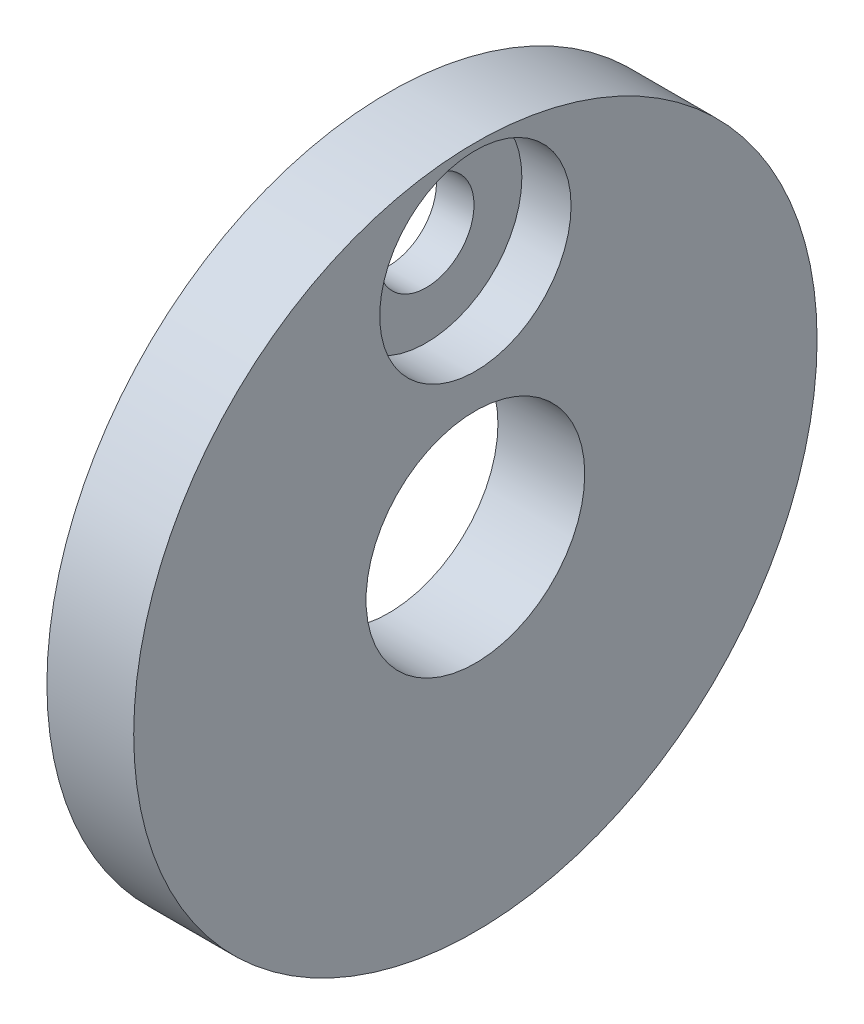
from build123d import *

# Parameters (mm, degrees)
SKETCH1_R           = 12.5
BOSS_EXTRUDE1_DEPTH = 3.175
SKETCH3_R           = 4
CUT_EXTRUDE1_DEPTH  = 18.960529641
SKETCH2_R           = 1.75
CUT_EXTRUDE2_DEPTH  = 18.960529641
SKETCH4_R           = 3.5
CUT_EXTRUDE3_DEPTH  = 1.8


with BuildPart() as part:
    # Sketch1 → Boss-Extrude1 (new body)
    with BuildSketch(Plane(origin=(0, 0, 0), x_dir=(0, 0, -1), z_dir=(1, 0, 0))):
        Circle(SKETCH1_R)
    extrude(amount=BOSS_EXTRUDE1_DEPTH)

    # Sketch3 → Cut-Extrude1 (cut, through all)
    with BuildSketch(Plane(origin=(3.175, 0, 0), x_dir=(0, 0, -1), z_dir=(1, 0, 0))):
        Circle(SKETCH3_R)
    extrude(amount=-CUT_EXTRUDE1_DEPTH, mode=Mode.SUBTRACT)

    # Sketch2 → Cut-Extrude2 (cut, through all)
    with BuildSketch(Plane(origin=(3.175, 0, 0), x_dir=(0, 0, -1), z_dir=(1, 0, 0))):
        with Locations((0, 8.75)):
            Circle(SKETCH2_R)
    extrude(amount=-CUT_EXTRUDE2_DEPTH, mode=Mode.SUBTRACT)

    # Sketch4 → Cut-Extrude3 (cut)
    with BuildSketch(Plane(origin=(3.175, 0, 0), x_dir=(0, 0, -1), z_dir=(1, 0, 0))):
        with Locations((0, 8.75)):
            Circle(SKETCH4_R)
    extrude(amount=-CUT_EXTRUDE3_DEPTH, mode=Mode.SUBTRACT)


solid = part.part
